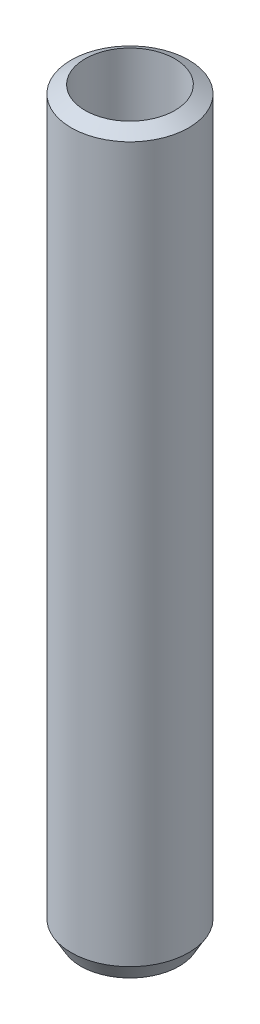
from build123d import *

# Parameters (mm, degrees)
SKETCH1_R           = 25
BOSS_EXTRUDE1_DEPTH = 315.095017
SKETCH2_R           = 19.079270484
CUT_EXTRUDE1_DEPTH  = 318.07234149
CHAMFER1_SIZE       = 4.06661
CHAMFER1_SIZE_2     = 7.043576


with BuildPart() as part:
    # Sketch1 → Boss-Extrude1 (new body)
    with BuildSketch(Plane(origin=(0, 0, 0), x_dir=(1, 0, 0), z_dir=(0, 1, 0))):
        with Locations(Location((0, 0, 0), (0, 0, 270))):
            Circle(SKETCH1_R)
    extrude(amount=BOSS_EXTRUDE1_DEPTH)

    # Sketch2 → Cut-Extrude1 (cut, through all)
    with BuildSketch(Plane(origin=(0, 0, 0), x_dir=(1, 0, 0), z_dir=(0, 1, 0))):
        with Locations(Location((0, 0, 0), (0, 0, 270))):
            Circle(SKETCH2_R)
    extrude(amount=CUT_EXTRUDE1_DEPTH, mode=Mode.SUBTRACT)

    # Chamfer1
    # the kernel refuses this chamfer: 7.043576, 4.06661 mm, written as the material it takes off along each edge
    with BuildSketch(Plane(origin=(0, 315.095017, 0), x_dir=(0, 0, 1), z_dir=(-1, 0, 0))) as chamfer1_piece_1:
        Polygon((25, -CHAMFER1_SIZE), (25 - CHAMFER1_SIZE_2, 0), (25, 0), align=None)
    revolve(axis=Axis((0, 315.095017, 0), (0, 1, 0)), mode=Mode.SUBTRACT)
    with BuildSketch(Plane(origin=(0, 0, 0), x_dir=(0, 0, 1), z_dir=(-1, 0, 0))) as chamfer1_piece_2:
        Polygon((25, CHAMFER1_SIZE_2), (25 - CHAMFER1_SIZE, 0), (25, 0), align=None)
    revolve(axis=Axis((0, 0, 0), (0, 1, 0)), mode=Mode.SUBTRACT)


solid = part.part
